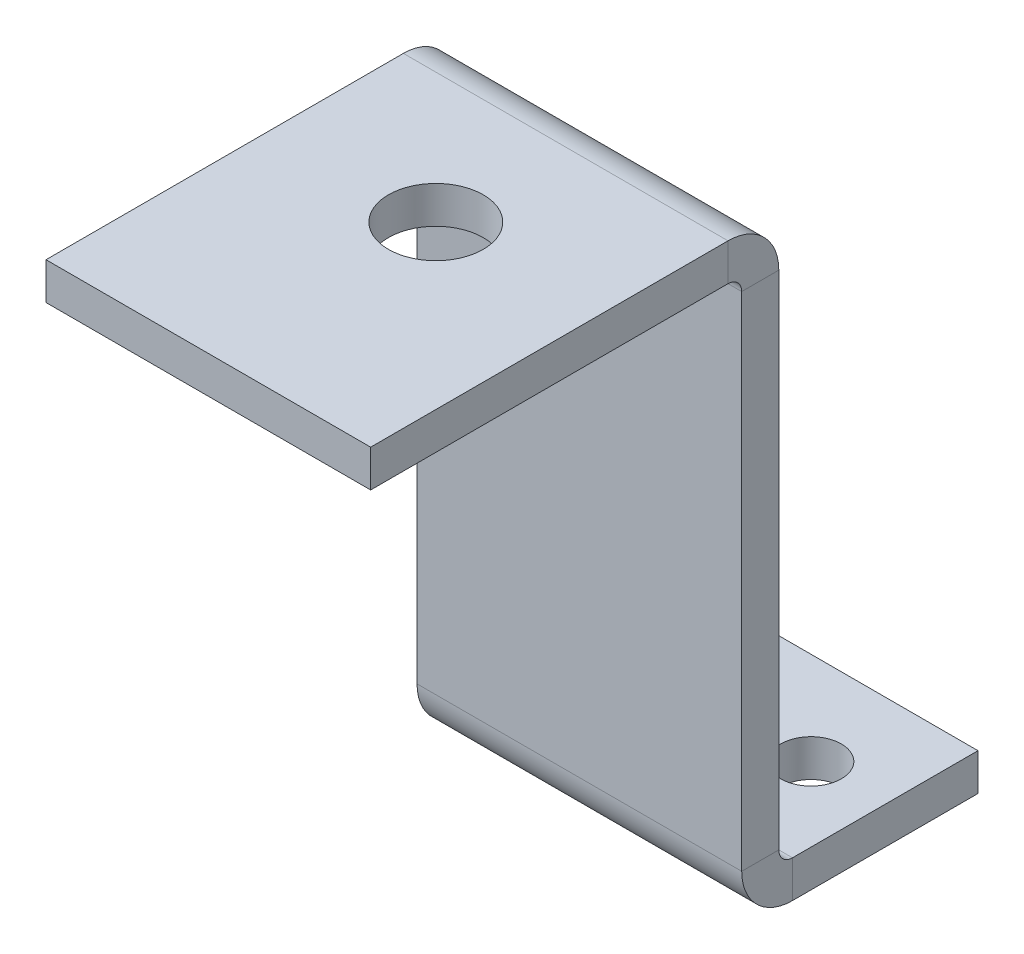
from build123d import *

# Parameters (mm, degrees)
SKETCH1_W                  = 17.5
SKETCH1_H                  = 10
BASE_FLANGE1_DEPTH         = 2
F_4_CLEARANCE_HOLE1_D      = 3.2639
F_4_CLEARANCE_HOLE1_DEPTH  = 2
F_4_CLEARANCE_HOLE1_TIP    = 0.980574487
EDGE_FLANGE2_DEPTH         = 17.5
EDGE_FLANGE3_DEPTH         = 17.5
F_10_CLEARANCE_HOLE1_D     = 5.1054
F_10_CLEARANCE_HOLE1_DEPTH = 7.6
F_10_CLEARANCE_HOLE1_TIP   = 1.533816902


# Sheet-metal steps are written as plain solids
with BuildPart() as part:
    # Sketch1 → Base-Flange1 (new body)
    with BuildSketch(Plane(origin=(0, 0, 0), x_dir=(1, 0, 0), z_dir=(0, 1, 0))):
        with Locations((-14.536713287, 16.32983683)):
            Rectangle(SKETCH1_W, SKETCH1_H)
    extrude(amount=-BASE_FLANGE1_DEPTH)

    # #4 Clearance Hole1
    with Locations(Plane.XZ.offset(2)):
        with Locations((-9.786713287, -16.32983683), (-19.286713287, -16.32983683)):
            Hole(F_4_CLEARANCE_HOLE1_D / 2, depth=F_4_CLEARANCE_HOLE1_DEPTH)
            with Locations((0, 0, -(F_4_CLEARANCE_HOLE1_DEPTH + F_4_CLEARANCE_HOLE1_TIP / 2))):  # 118° drill point
                Cone(0, F_4_CLEARANCE_HOLE1_D / 2, F_4_CLEARANCE_HOLE1_TIP, mode=Mode.SUBTRACT)

    # Edge-Flange2 section (across the edge) → Edge-Flange2 (add)
    with BuildSketch(Plane(origin=(-23.286713287, 0, -10.59323683), x_dir=(0, 0, -1), z_dir=(1, 0, 0))):
        with BuildLine():
            Line((-2, 0.7366), (-2, 27.8))
            Line((-2, 27.8), (0, 27.8))
            Line((0, 27.8), (0, 0.7366))
            ThreePointArc((0, 0.7366), (0.215745145, 0.215745145), (0.7366, 0))
            Line((0.7366, 0), (0.7366, -2))
            ThreePointArc((0.7366, -2), (-1.198468417, -1.198468417), (-2, 0.7366))
        make_face()
    extrude(amount=EDGE_FLANGE2_DEPTH)

    # Edge-Flange3 section (across the edge) → Edge-Flange3 (add)
    with BuildSketch(Plane(origin=(-5.786713287, 28.5366, -8.59323683), x_dir=(0, -1, 0), z_dir=(-1, 0, 0))):
        with BuildLine():
            Line((-2, 0.7366), (-2, 20))
            Line((-2, 20), (0, 20))
            Line((0, 20), (0, 0.7366))
            ThreePointArc((0, 0.7366), (0.215745145, 0.215745145), (0.7366, 0))
            Line((0.7366, 0), (0.7366, -2))
            ThreePointArc((0.7366, -2), (-1.198468417, -1.198468417), (-2, 0.7366))
        make_face()
    extrude(amount=EDGE_FLANGE3_DEPTH)

    # #10 Clearance Hole1
    with Locations(Plane(origin=(0, 28.5366, 0), x_dir=(-1, 0, 0), z_dir=(0, -1, 0))):
        with Locations((14.536713287, 0.85663683)):
            Hole(F_10_CLEARANCE_HOLE1_D / 2, depth=F_10_CLEARANCE_HOLE1_DEPTH)
            with Locations((0, 0, -(F_10_CLEARANCE_HOLE1_DEPTH + F_10_CLEARANCE_HOLE1_TIP / 2))):  # 118° drill point
                Cone(0, F_10_CLEARANCE_HOLE1_D / 2, F_10_CLEARANCE_HOLE1_TIP, mode=Mode.SUBTRACT)


solid = part.part
